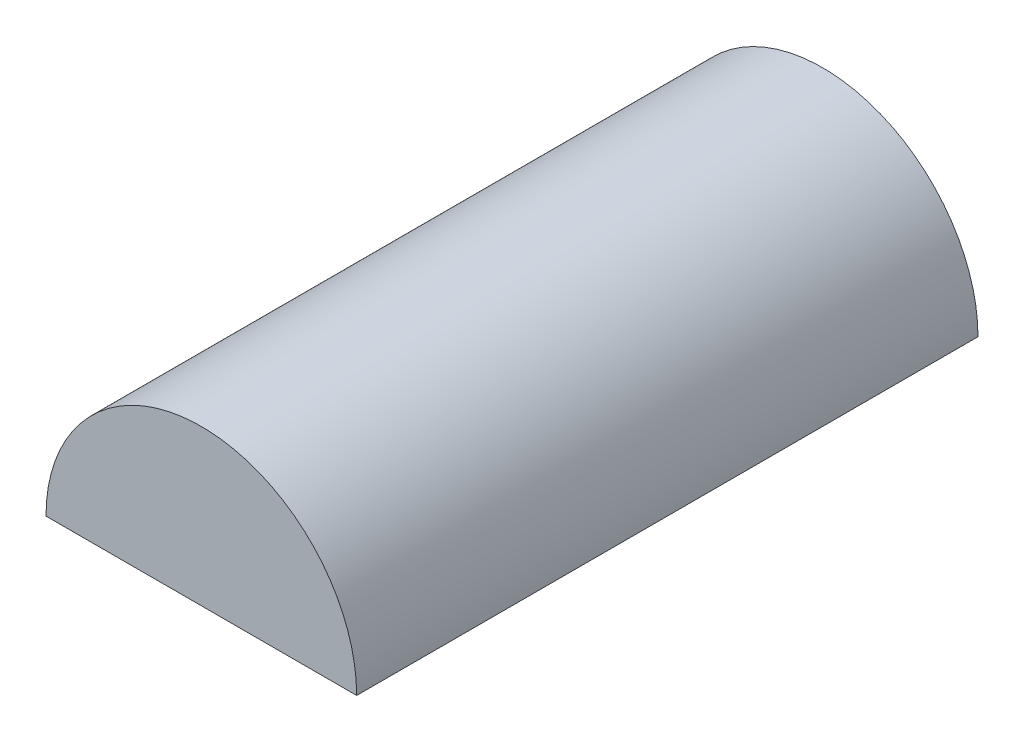
from build123d import *

# Parameters (mm, degrees)
BOSS_EXTRUDE1_DEPTH = 406.4
SHELL1_T            = -6.35


with BuildPart() as part:
    # Sketch1 → Boss-Extrude1 (new body)
    with BuildSketch(Plane.XY):
        with BuildLine():
            Line((-101.6, 0), (101.6, 0))
            ThreePointArc((101.6, 0), (0, 101.6), (-101.6, 0))
        make_face()
    extrude(amount=BOSS_EXTRUDE1_DEPTH)

    # Shell1
    shell1_openings = [part.faces().sort_by_distance(p)[0] for p in [
        (0, 0, 203.2),
    ]]
    offset(amount=SHELL1_T, openings=shell1_openings)


solid = part.part
